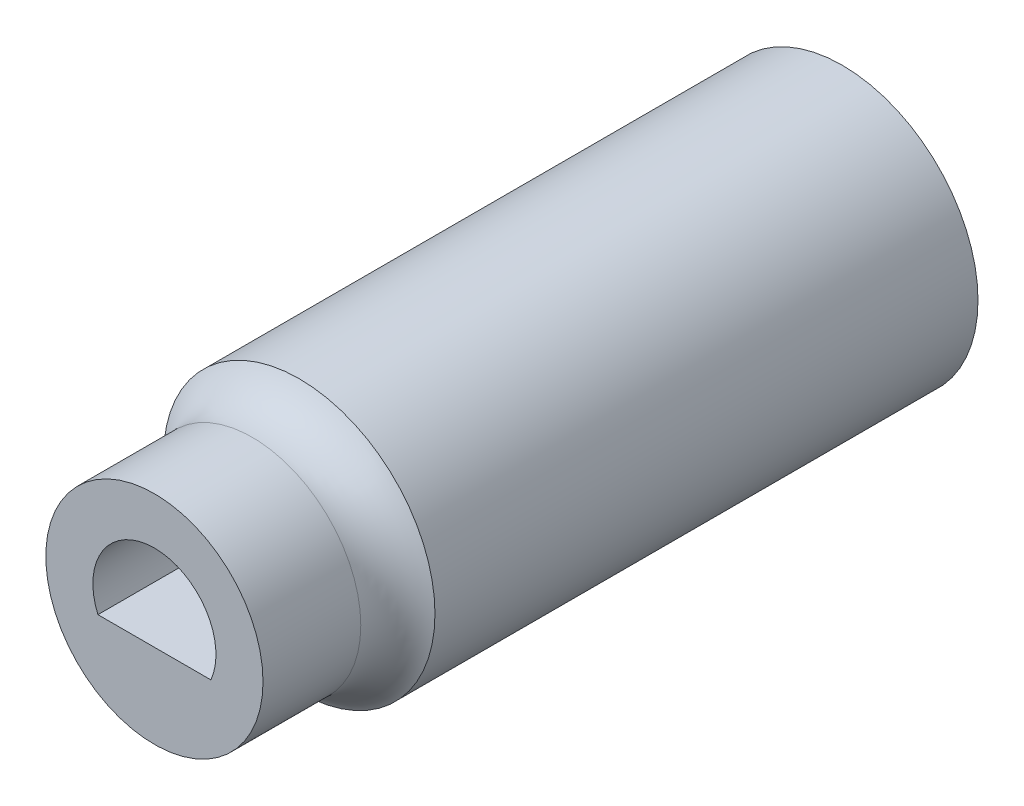
from build123d import *

# Parameters (mm, degrees)
IZIM1_R                     = 7.5
Y_KSEKLIK_EKSTR_ZYON1_DEPTH = 38
KES_EKSTR_ZYON1_DEPTH       = 9.5
KES_EKSTR_ZYON3_DEPTH       = 25
KES_EKSTR_ZYON4_START       = -8
IZIM4_R                     = 7.5
IZIM4_R_2                   = 6
KES_EKSTR_ZYON4_DEPTH       = 8
RADYUS1_R                   = 3
KES_EKSTR_ZYON5_DEPTH       = 10
KES_EKSTR_ZYON6_DEPTH       = 25
KES_EKSTR_ZYON7_DEPTH       = 25


with BuildPart() as part:
    # Çizim1 → Yükseklik-Ekstrüzyon1 (new body)
    with BuildSketch(Plane.XY):
        Circle(IZIM1_R)
    extrude(amount=Y_KSEKLIK_EKSTR_ZYON1_DEPTH)

    # Çizim2 → Kes-Ekstrüzyon1 (cut)
    with BuildSketch(Plane.XY.offset(38)):
        with BuildLine():
            Line((0, -1.35), (-2.734958866, -1.35))
            ThreePointArc((-2.734958866, -1.35), (0, 3.05), (2.734958866, -1.35))
            Line((2.734958866, -1.35), (0, -1.35))
        make_face()
    extrude(amount=-KES_EKSTR_ZYON1_DEPTH, mode=Mode.SUBTRACT)

    # Çizim3 → Kes-Ekstrüzyon3 (cut)
    with BuildSketch(Plane(origin=(0, 0, 0), x_dir=(-1, 0, 0), z_dir=(0, 0, -1))):
        with BuildLine():
            Line((0, -2.05), (-3.258834147, -2.05))
            ThreePointArc((-3.258834147, -2.05), (0, 3.85), (3.258834147, -2.05))
            Line((3.258834147, -2.05), (0, -2.05))
        make_face()
    extrude(amount=-KES_EKSTR_ZYON3_DEPTH, mode=Mode.SUBTRACT)

    # Çizim4 → Kes-Ekstrüzyon4 (cut)
    with BuildSketch(Plane.XY.offset(38).offset(KES_EKSTR_ZYON4_START)):
        Circle(IZIM4_R)
        Circle(IZIM4_R_2, mode=Mode.SUBTRACT)
    extrude(amount=KES_EKSTR_ZYON4_DEPTH, mode=Mode.SUBTRACT)

    # Radyus1
    # the kernel refuses this fillet: 3 mm, written as the material it adds along each edge
    with BuildSketch(Plane(origin=(0, 0, 30), x_dir=(1, 0, 0), z_dir=(0, -1, 0))) as radyus1_piece_1:
        with BuildLine():
            CenterArc((9, 2.598076211), RADYUS1_R, 180, 60)
            Line((6, 2.598076211), (5.94, 2.598076211))
            Line((5.94, 2.598076211), (5.94, 0))
            Line((5.94, 0), (6, -0.06))
            ThreePointArc((6, -0.06), (6.75, -0.06), (7.47, -0.051961524))
            Line((7.47, -0.051961524), (7.5, 0))
        make_face()
    revolve(axis=Axis((0, 0, 30), (0, 0, 1)))

    # Çizim5 → Kes-Ekstrüzyon5 (cut)
    with BuildSketch(Plane.XY.offset(38)):
        with BuildLine():
            Line((-3.120496755, -1.35), (3.120496755, -1.35))
            ThreePointArc((3.120496755, -1.35), (0, 3.4), (-3.120496755, -1.35))
        make_face()
    extrude(amount=-KES_EKSTR_ZYON5_DEPTH, mode=Mode.SUBTRACT)

    # Çizim6 → Kes-Ekstrüzyon6 (cut)
    with BuildSketch(Plane(origin=(0, 0, 0), x_dir=(-1, 0, 0), z_dir=(0, 0, -1))):
        with BuildLine():
            Line((-3.434748899, -2.05), (3.434748899, -2.05))
            ThreePointArc((3.434748899, -2.05), (0, 4), (-3.434748899, -2.05))
        make_face()
    extrude(amount=-KES_EKSTR_ZYON6_DEPTH, mode=Mode.SUBTRACT)

    # Çizim8 → Kes-Ekstrüzyon7 (cut)
    with BuildSketch(Plane(origin=(0, 0, 0), x_dir=(-1, 0, 0), z_dir=(0, 0, -1))):
        with BuildLine():
            Line((-3.893263413, -2.05), (3.893263413, -2.05))
            ThreePointArc((3.893263413, -2.05), (0, 4.4), (-3.893263413, -2.05))
        make_face()
    extrude(amount=-KES_EKSTR_ZYON7_DEPTH, mode=Mode.SUBTRACT)


solid = part.part
